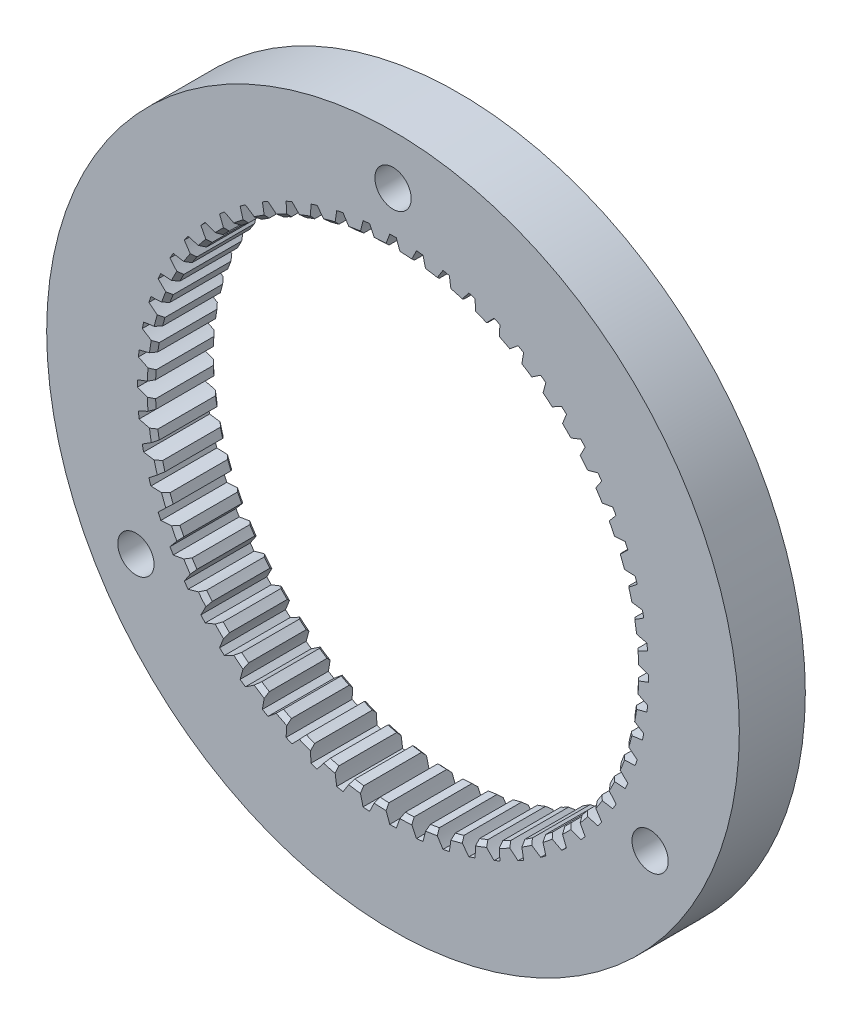
from build123d import *

# Parameters (mm, degrees)
MODEL_R                        = 21
BOSS_EXTRUDE1_DEPTH            = 4
M2_CLEARANCE_HOLE1_D           = 2.2
M2_CLEARANCE_HOLE1_CSINK_D     = 4
M2_CLEARANCE_HOLE1_CSINK_ANGLE = 90
CHAMFER1_SIZE                  = 0.25
CHAMFER2_SIZE                  = 0.25


with BuildPart() as part:
    # Model → Boss-Extrude1 (new body)
    with BuildSketch(Plane.XY):
        Circle(MODEL_R)
        with BuildLine():
            ThreePointArc((14.612478706, -1.037074251), (14.629157739, -0.76668167), (14.640833797, -0.496026894))
            add(Edge.make_bspline(
                [(15.498800652, -0.196378454), (15.258466931, -0.302654065), (15.044300113, -0.379806762), (14.640833797, -0.496026894)],
                knots=[0, 0, 0, 0, 1, 1, 1, 1], degree=3))
            ThreePointArc((15.498800652, -0.196378454), (15.500044715, 0), (15.498800652, 0.196378454))
            add(Edge.make_bspline(
                [(14.640833797, 0.496026894), (15.044300113, 0.379806762), (15.258466931, 0.302654065), (15.498800652, 0.196378454)],
                knots=[0, 0, 0, 0, 1, 1, 1, 1], degree=3))
            ThreePointArc((14.640833797, 0.496026894), (14.629157739, 0.76668167), (14.612478706, 1.037074251))
            add(Edge.make_bspline(
                [(15.434423738, 1.424763143), (15.206515417, 1.293948006), (15.00158648, 1.194831431), (14.612478706, 1.037074251)],
                knots=[0, 0, 0, 0, 1, 1, 1, 1], degree=3))
            ThreePointArc((15.434423738, 1.424763143), (15.415133848, 1.620195855), (15.393369463, 1.815368487))
            add(Edge.make_bspline(
                [(14.508780848, 2.023693465), (14.922185246, 1.950283713), (15.143243489, 1.895940195), (15.393369463, 1.815368487)],
                knots=[0, 0, 0, 0, 1, 1, 1, 1], degree=3))
            ThreePointArc((14.508780848, 2.023693465), (14.468877626, 2.291645085), (14.424026241, 2.558812993))
            add(Edge.make_bspline(
                [(15.200944048, 3.030294736), (14.987958138, 2.876373311), (14.794512327, 2.7563788), (14.424026241, 2.558812993)],
                knots=[0, 0, 0, 0, 1, 1, 1, 1], degree=3))
            ThreePointArc((15.200944048, 3.030294736), (15.161331549, 3.222640504), (15.119285296, 3.414468963))
            add(Edge.make_bspline(
                [(14.217766661, 3.529188026), (14.636579794, 3.499392947), (14.862107501, 3.468454007), (15.119285296, 3.414468963)],
                knots=[0, 0, 0, 0, 1, 1, 1, 1], degree=3))
            ThreePointArc((14.217766661, 3.529188026), (14.150073461, 3.791500757), (14.077541126, 4.052516845))
            add(Edge.make_bspline(
                [(14.800919635, 4.602625786), (14.605189653, 4.427284469), (14.4253464, 4.287726707), (14.077541126, 4.052516845)],
                knots=[0, 0, 0, 0, 1, 1, 1, 1], degree=3))
            ThreePointArc((14.800919635, 4.602625786), (14.741418529, 4.78977723), (14.679551075, 4.976159802))
            add(Edge.make_bspline(
                [(13.770979646, 4.996016065), (14.190612912, 5.0101621), (14.418139154, 5.002966711), (14.679551075, 4.976159802)],
                knots=[0, 0, 0, 0, 1, 1, 1, 1], degree=3))
            ThreePointArc((13.770979646, 4.996016065), (13.67623813, 5.249815953), (13.576819525, 5.501820474))
            add(Edge.make_bspline(
                [(14.238733248, 6.124529505), (14.062403654, 5.929689372), (13.898133359, 5.772097383), (13.576819525, 5.501820474)],
                knots=[0, 0, 0, 0, 1, 1, 1, 1], degree=3))
            ThreePointArc((14.238733248, 6.124529505), (14.159995442, 6.304436155), (14.078984622, 6.483330793))
            add(Edge.make_bspline(
                [(13.173314897, 6.408106706), (13.589170704, 6.466038868), (13.816202657, 6.482665865), (14.078984622, 6.483330793)],
                knots=[0, 0, 0, 0, 1, 1, 1, 1], degree=3))
            ThreePointArc((13.173314897, 6.408106706), (13.052563073, 6.650613067), (12.927347448, 6.890845007))
            add(Edge.make_bspline(
                [(13.52054432, 7.579331596), (13.365547018, 7.367127357), (13.218649461, 7.193227752), (12.927347448, 6.890845007)],
                knots=[0, 0, 0, 0, 1, 1, 1, 1], degree=3))
            ThreePointArc((13.52054432, 7.579331596), (13.423432483, 7.750022357), (13.324165866, 7.919469056))
            add(Edge.make_bspline(
                [(12.431320553, 7.74998879), (12.838842699, 7.851072361), (13.062892953, 7.891339575), (13.324165866, 7.919469056)],
                knots=[0, 0, 0, 0, 1, 1, 1, 1], degree=3))
            ThreePointArc((12.431320553, 7.74998879), (12.285881403, 7.978544672), (12.136240646, 8.204372))
            add(Edge.make_bspline(
                [(12.654221479, 8.951092945), (12.522254652, 8.723849553), (12.394339274, 8.535547612), (12.136240646, 8.204372)],
                knots=[0, 0, 0, 0, 1, 1, 1, 1], degree=3))
            ThreePointArc((12.654221479, 8.951092945), (12.539799588, 9.110697693), (12.423364761, 9.268839958))
            add(Edge.make_bspline(
                [(11.55312606, 9.006960374), (11.947849646, 9.150087863), (12.16646346, 9.213554117), (12.423364761, 9.268839958)],
                knots=[0, 0, 0, 0, 1, 1, 1, 1], degree=3))
            ThreePointArc((11.55312606, 9.006960374), (11.384593046, 9.219061673), (11.212166653, 9.428010176))
            add(Edge.make_bspline(
                [(11.64925634, 10.224784246), (11.541765843, 9.984991427), (11.434234111, 9.784350227), (11.212166653, 9.428010176)],
                knots=[0, 0, 0, 0, 1, 1, 1, 1], degree=3))
            ThreePointArc((11.64925634, 10.224784246), (11.518778024, 10.371554318), (11.386450672, 10.51665951))
            add(Edge.make_bspline(
                [(10.5483531, 10.165249816), (10.925953453, 10.348853087), (11.136735647, 10.434823032), (11.386450672, 10.51665951)],
                knots=[0, 0, 0, 0, 1, 1, 1, 1], degree=3))
            ThreePointArc((10.5483531, 10.165249816), (10.358572704, 10.358572704), (10.165249816, 10.5483531))
            add(Edge.make_bspline(
                [(10.51665951, 11.386450672), (10.434823032, 11.136735647), (10.348853087, 10.925953453), (10.165249816, 10.5483531)],
                knots=[0, 0, 0, 0, 1, 1, 1, 1], degree=3))
            ThreePointArc((10.51665951, 11.386450672), (10.371554318, 11.518778024), (10.224784246, 11.64925634))
            add(Edge.make_bspline(
                [(9.428010176, 11.212166653), (9.784350227, 11.434234111), (9.984991427, 11.541765843), (10.224784246, 11.64925634)],
                knots=[0, 0, 0, 0, 1, 1, 1, 1], degree=3))
            ThreePointArc((9.428010176, 11.212166653), (9.219061673, 11.384593046), (9.006960374, 11.55312606))
            add(Edge.make_bspline(
                [(9.268839958, 12.423364761), (9.213554117, 12.16646346), (9.150087863, 11.947849646), (9.006960374, 11.55312606)],
                knots=[0, 0, 0, 0, 1, 1, 1, 1], degree=3))
            ThreePointArc((9.268839958, 12.423364761), (9.110697693, 12.539799588), (8.951092945, 12.654221479))
            add(Edge.make_bspline(
                [(8.204372, 12.136240646), (8.535547612, 12.394339274), (8.723849553, 12.522254652), (8.951092945, 12.654221479)],
                knots=[0, 0, 0, 0, 1, 1, 1, 1], degree=3))
            ThreePointArc((8.204372, 12.136240646), (7.978544672, 12.285881403), (7.74998879, 12.431320553))
            add(Edge.make_bspline(
                [(7.919469056, 13.324165866), (7.891339575, 13.062892953), (7.851072361, 12.838842699), (7.74998879, 12.431320553)],
                knots=[0, 0, 0, 0, 1, 1, 1, 1], degree=3))
            ThreePointArc((7.919469056, 13.324165866), (7.750022357, 13.423432483), (7.579331596, 13.52054432))
            add(Edge.make_bspline(
                [(6.890845007, 12.927347448), (7.193227752, 13.218649461), (7.367127357, 13.365547018), (7.579331596, 13.52054432)],
                knots=[0, 0, 0, 0, 1, 1, 1, 1], degree=3))
            ThreePointArc((6.890845007, 12.927347448), (6.650613067, 13.052563073), (6.408106706, 13.173314897))
            add(Edge.make_bspline(
                [(6.483330793, 14.078984622), (6.482665865, 13.816202657), (6.466038868, 13.589170704), (6.408106706, 13.173314897)],
                knots=[0, 0, 0, 0, 1, 1, 1, 1], degree=3))
            ThreePointArc((6.483330793, 14.078984622), (6.304436155, 14.159995442), (6.124529505, 14.238733248))
            add(Edge.make_bspline(
                [(5.501820474, 13.576819525), (5.772097383, 13.898133359), (5.929689372, 14.062403654), (6.124529505, 14.238733248)],
                knots=[0, 0, 0, 0, 1, 1, 1, 1], degree=3))
            ThreePointArc((5.501820474, 13.576819525), (5.249815953, 13.67623813), (4.996016065, 13.770979646))
            add(Edge.make_bspline(
                [(4.976159802, 14.679551075), (5.002966711, 14.418139154), (5.0101621, 14.190612912), (4.996016065, 13.770979646)],
                knots=[0, 0, 0, 0, 1, 1, 1, 1], degree=3))
            ThreePointArc((4.976159802, 14.679551075), (4.78977723, 14.741418529), (4.602625786, 14.800919635))
            add(Edge.make_bspline(
                [(4.052516845, 14.077541126), (4.287726707, 14.4253464), (4.427284469, 14.605189653), (4.602625786, 14.800919635)],
                knots=[0, 0, 0, 0, 1, 1, 1, 1], degree=3))
            ThreePointArc((4.052516845, 14.077541126), (3.791500757, 14.150073461), (3.529188026, 14.217766661))
            add(Edge.make_bspline(
                [(3.414468963, 15.119285296), (3.468454007, 14.862107501), (3.499392947, 14.636579794), (3.529188026, 14.217766661)],
                knots=[0, 0, 0, 0, 1, 1, 1, 1], degree=3))
            ThreePointArc((3.414468963, 15.119285296), (3.222640504, 15.161331549), (3.030294736, 15.200944048))
            add(Edge.make_bspline(
                [(2.558812993, 14.424026241), (2.7563788, 14.794512327), (2.876373311, 14.987958138), (3.030294736, 15.200944048)],
                knots=[0, 0, 0, 0, 1, 1, 1, 1], degree=3))
            ThreePointArc((2.558812993, 14.424026241), (2.291645085, 14.468877626), (2.023693465, 14.508780848))
            add(Edge.make_bspline(
                [(1.815368487, 15.393369463), (1.895940195, 15.143243489), (1.950283713, 14.922185246), (2.023693465, 14.508780848)],
                knots=[0, 0, 0, 0, 1, 1, 1, 1], degree=3))
            ThreePointArc((1.815368487, 15.393369463), (1.620195855, 15.415133848), (1.424763143, 15.434423738))
            add(Edge.make_bspline(
                [(1.037074251, 14.612478706), (1.194831431, 15.00158648), (1.293948006, 15.206515417), (1.424763143, 15.434423738)],
                knots=[0, 0, 0, 0, 1, 1, 1, 1], degree=3))
            ThreePointArc((1.037074251, 14.612478706), (0.76668167, 14.629157739), (0.496026894, 14.640833797))
            add(Edge.make_bspline(
                [(0.196378454, 15.498800652), (0.302654065, 15.258466931), (0.379806762, 15.044300113), (0.496026894, 14.640833797)],
                knots=[0, 0, 0, 0, 1, 1, 1, 1], degree=3))
            ThreePointArc((0.196378454, 15.498800652), (0, 15.500044715), (-0.196378454, 15.498800652))
            add(Edge.make_bspline(
                [(-0.496026894, 14.640833797), (-0.379806762, 15.044300113), (-0.302654065, 15.258466931), (-0.196378454, 15.498800652)],
                knots=[0, 0, 0, 0, 1, 1, 1, 1], degree=3))
            ThreePointArc((-0.496026894, 14.640833797), (-0.76668167, 14.629157739), (-1.037074251, 14.612478706))
            add(Edge.make_bspline(
                [(-1.424763143, 15.434423738), (-1.293948006, 15.206515417), (-1.194831431, 15.00158648), (-1.037074251, 14.612478706)],
                knots=[0, 0, 0, 0, 1, 1, 1, 1], degree=3))
            ThreePointArc((-1.424763143, 15.434423738), (-1.620195855, 15.415133848), (-1.815368487, 15.393369463))
            add(Edge.make_bspline(
                [(-2.023693465, 14.508780848), (-1.950283713, 14.922185246), (-1.895940195, 15.143243489), (-1.815368487, 15.393369463)],
                knots=[0, 0, 0, 0, 1, 1, 1, 1], degree=3))
            ThreePointArc((-2.023693465, 14.508780848), (-2.291645085, 14.468877626), (-2.558812993, 14.424026241))
            add(Edge.make_bspline(
                [(-3.030294736, 15.200944048), (-2.876373311, 14.987958138), (-2.7563788, 14.794512327), (-2.558812993, 14.424026241)],
                knots=[0, 0, 0, 0, 1, 1, 1, 1], degree=3))
            ThreePointArc((-3.030294736, 15.200944048), (-3.222640504, 15.161331549), (-3.414468963, 15.119285296))
            add(Edge.make_bspline(
                [(-3.529188026, 14.217766661), (-3.499392947, 14.636579794), (-3.468454007, 14.862107501), (-3.414468963, 15.119285296)],
                knots=[0, 0, 0, 0, 1, 1, 1, 1], degree=3))
            ThreePointArc((-3.529188026, 14.217766661), (-3.791500757, 14.150073461), (-4.052516845, 14.077541126))
            add(Edge.make_bspline(
                [(-4.602625786, 14.800919635), (-4.427284469, 14.605189653), (-4.287726707, 14.4253464), (-4.052516845, 14.077541126)],
                knots=[0, 0, 0, 0, 1, 1, 1, 1], degree=3))
            ThreePointArc((-4.602625786, 14.800919635), (-4.78977723, 14.741418529), (-4.976159802, 14.679551075))
            add(Edge.make_bspline(
                [(-4.996016065, 13.770979646), (-5.0101621, 14.190612912), (-5.002966711, 14.418139154), (-4.976159802, 14.679551075)],
                knots=[0, 0, 0, 0, 1, 1, 1, 1], degree=3))
            ThreePointArc((-4.996016065, 13.770979646), (-5.249815953, 13.67623813), (-5.501820474, 13.576819525))
            add(Edge.make_bspline(
                [(-6.124529505, 14.238733248), (-5.929689372, 14.062403654), (-5.772097383, 13.898133359), (-5.501820474, 13.576819525)],
                knots=[0, 0, 0, 0, 1, 1, 1, 1], degree=3))
            ThreePointArc((-6.124529505, 14.238733248), (-6.304436155, 14.159995442), (-6.483330793, 14.078984622))
            add(Edge.make_bspline(
                [(-6.408106706, 13.173314897), (-6.466038868, 13.589170704), (-6.482665865, 13.816202657), (-6.483330793, 14.078984622)],
                knots=[0, 0, 0, 0, 1, 1, 1, 1], degree=3))
            ThreePointArc((-6.408106706, 13.173314897), (-6.650613067, 13.052563073), (-6.890845007, 12.927347448))
            add(Edge.make_bspline(
                [(-7.579331596, 13.52054432), (-7.367127357, 13.365547018), (-7.193227752, 13.218649461), (-6.890845007, 12.927347448)],
                knots=[0, 0, 0, 0, 1, 1, 1, 1], degree=3))
            ThreePointArc((-7.579331596, 13.52054432), (-7.750022357, 13.423432483), (-7.919469056, 13.324165866))
            add(Edge.make_bspline(
                [(-7.74998879, 12.431320553), (-7.851072361, 12.838842699), (-7.891339575, 13.062892953), (-7.919469056, 13.324165866)],
                knots=[0, 0, 0, 0, 1, 1, 1, 1], degree=3))
            ThreePointArc((-7.74998879, 12.431320553), (-7.978544672, 12.285881403), (-8.204372, 12.136240646))
            add(Edge.make_bspline(
                [(-8.951092945, 12.654221479), (-8.723849553, 12.522254652), (-8.535547612, 12.394339274), (-8.204372, 12.136240646)],
                knots=[0, 0, 0, 0, 1, 1, 1, 1], degree=3))
            ThreePointArc((-8.951092945, 12.654221479), (-9.110697693, 12.539799588), (-9.268839958, 12.423364761))
            add(Edge.make_bspline(
                [(-9.006960374, 11.55312606), (-9.150087863, 11.947849646), (-9.213554117, 12.16646346), (-9.268839958, 12.423364761)],
                knots=[0, 0, 0, 0, 1, 1, 1, 1], degree=3))
            ThreePointArc((-9.006960374, 11.55312606), (-9.219061673, 11.384593046), (-9.428010176, 11.212166653))
            add(Edge.make_bspline(
                [(-10.224784246, 11.64925634), (-9.984991427, 11.541765843), (-9.784350227, 11.434234111), (-9.428010176, 11.212166653)],
                knots=[0, 0, 0, 0, 1, 1, 1, 1], degree=3))
            ThreePointArc((-10.224784246, 11.64925634), (-10.371554318, 11.518778024), (-10.51665951, 11.386450672))
            add(Edge.make_bspline(
                [(-10.165249816, 10.5483531), (-10.348853087, 10.925953453), (-10.434823032, 11.136735647), (-10.51665951, 11.386450672)],
                knots=[0, 0, 0, 0, 1, 1, 1, 1], degree=3))
            ThreePointArc((-10.165249816, 10.5483531), (-10.358572704, 10.358572704), (-10.5483531, 10.165249816))
            add(Edge.make_bspline(
                [(-11.386450672, 10.51665951), (-11.136735647, 10.434823032), (-10.925953453, 10.348853087), (-10.5483531, 10.165249816)],
                knots=[0, 0, 0, 0, 1, 1, 1, 1], degree=3))
            ThreePointArc((-11.386450672, 10.51665951), (-11.518778024, 10.371554318), (-11.64925634, 10.224784246))
            add(Edge.make_bspline(
                [(-11.212166653, 9.428010176), (-11.434234111, 9.784350227), (-11.541765843, 9.984991427), (-11.64925634, 10.224784246)],
                knots=[0, 0, 0, 0, 1, 1, 1, 1], degree=3))
            ThreePointArc((-11.212166653, 9.428010176), (-11.384593046, 9.219061673), (-11.55312606, 9.006960374))
            add(Edge.make_bspline(
                [(-12.423364761, 9.268839958), (-12.16646346, 9.213554117), (-11.947849646, 9.150087863), (-11.55312606, 9.006960374)],
                knots=[0, 0, 0, 0, 1, 1, 1, 1], degree=3))
            ThreePointArc((-12.423364761, 9.268839958), (-12.539799588, 9.110697693), (-12.654221479, 8.951092945))
            add(Edge.make_bspline(
                [(-12.136240646, 8.204372), (-12.394339274, 8.535547612), (-12.522254652, 8.723849553), (-12.654221479, 8.951092945)],
                knots=[0, 0, 0, 0, 1, 1, 1, 1], degree=3))
            ThreePointArc((-12.136240646, 8.204372), (-12.285881403, 7.978544672), (-12.431320553, 7.74998879))
            add(Edge.make_bspline(
                [(-13.324165866, 7.919469056), (-13.062892953, 7.891339575), (-12.838842699, 7.851072361), (-12.431320553, 7.74998879)],
                knots=[0, 0, 0, 0, 1, 1, 1, 1], degree=3))
            ThreePointArc((-13.324165866, 7.919469056), (-13.423432483, 7.750022357), (-13.52054432, 7.579331596))
            add(Edge.make_bspline(
                [(-12.927347448, 6.890845007), (-13.218649461, 7.193227752), (-13.365547018, 7.367127357), (-13.52054432, 7.579331596)],
                knots=[0, 0, 0, 0, 1, 1, 1, 1], degree=3))
            ThreePointArc((-12.927347448, 6.890845007), (-13.052563073, 6.650613067), (-13.173314897, 6.408106706))
            add(Edge.make_bspline(
                [(-14.078984622, 6.483330793), (-13.816202657, 6.482665865), (-13.589170704, 6.466038868), (-13.173314897, 6.408106706)],
                knots=[0, 0, 0, 0, 1, 1, 1, 1], degree=3))
            ThreePointArc((-14.078984622, 6.483330793), (-14.159995442, 6.304436155), (-14.238733248, 6.124529505))
            add(Edge.make_bspline(
                [(-13.576819525, 5.501820474), (-13.898133359, 5.772097383), (-14.062403654, 5.929689372), (-14.238733248, 6.124529505)],
                knots=[0, 0, 0, 0, 1, 1, 1, 1], degree=3))
            ThreePointArc((-13.576819525, 5.501820474), (-13.67623813, 5.249815953), (-13.770979646, 4.996016065))
            add(Edge.make_bspline(
                [(-14.679551075, 4.976159802), (-14.418139154, 5.002966711), (-14.190612912, 5.0101621), (-13.770979646, 4.996016065)],
                knots=[0, 0, 0, 0, 1, 1, 1, 1], degree=3))
            ThreePointArc((-14.679551075, 4.976159802), (-14.741418529, 4.78977723), (-14.800919635, 4.602625786))
            add(Edge.make_bspline(
                [(-14.077541126, 4.052516845), (-14.4253464, 4.287726707), (-14.605189653, 4.427284469), (-14.800919635, 4.602625786)],
                knots=[0, 0, 0, 0, 1, 1, 1, 1], degree=3))
            ThreePointArc((-14.077541126, 4.052516845), (-14.150073461, 3.791500757), (-14.217766661, 3.529188026))
            add(Edge.make_bspline(
                [(-15.119285296, 3.414468963), (-14.862107501, 3.468454007), (-14.636579794, 3.499392947), (-14.217766661, 3.529188026)],
                knots=[0, 0, 0, 0, 1, 1, 1, 1], degree=3))
            ThreePointArc((-15.119285296, 3.414468963), (-15.161331549, 3.222640504), (-15.200944048, 3.030294736))
            add(Edge.make_bspline(
                [(-14.424026241, 2.558812993), (-14.794512327, 2.7563788), (-14.987958138, 2.876373311), (-15.200944048, 3.030294736)],
                knots=[0, 0, 0, 0, 1, 1, 1, 1], degree=3))
            ThreePointArc((-14.424026241, 2.558812993), (-14.468877626, 2.291645085), (-14.508780848, 2.023693465))
            add(Edge.make_bspline(
                [(-15.393369463, 1.815368487), (-15.143243489, 1.895940195), (-14.922185246, 1.950283713), (-14.508780848, 2.023693465)],
                knots=[0, 0, 0, 0, 1, 1, 1, 1], degree=3))
            ThreePointArc((-15.393369463, 1.815368487), (-15.415133848, 1.620195855), (-15.434423738, 1.424763143))
            add(Edge.make_bspline(
                [(-14.612478706, 1.037074251), (-15.00158648, 1.194831431), (-15.206515417, 1.293948006), (-15.434423738, 1.424763143)],
                knots=[0, 0, 0, 0, 1, 1, 1, 1], degree=3))
            ThreePointArc((-14.612478706, 1.037074251), (-14.629157739, 0.76668167), (-14.640833797, 0.496026894))
            add(Edge.make_bspline(
                [(-15.498800652, 0.196378454), (-15.258466931, 0.302654065), (-15.044300113, 0.379806762), (-14.640833797, 0.496026894)],
                knots=[0, 0, 0, 0, 1, 1, 1, 1], degree=3))
            ThreePointArc((-15.498800652, 0.196378454), (-15.500044715, 0), (-15.498800652, -0.196378454))
            add(Edge.make_bspline(
                [(-14.640833797, -0.496026894), (-15.044300113, -0.379806762), (-15.258466931, -0.302654065), (-15.498800652, -0.196378454)],
                knots=[0, 0, 0, 0, 1, 1, 1, 1], degree=3))
            ThreePointArc((-14.640833797, -0.496026894), (-14.629157739, -0.76668167), (-14.612478706, -1.037074251))
            add(Edge.make_bspline(
                [(-15.434423738, -1.424763143), (-15.206515417, -1.293948006), (-15.00158648, -1.194831431), (-14.612478706, -1.037074251)],
                knots=[0, 0, 0, 0, 1, 1, 1, 1], degree=3))
            ThreePointArc((-15.434423738, -1.424763143), (-15.415133848, -1.620195855), (-15.393369463, -1.815368487))
            add(Edge.make_bspline(
                [(-14.508780848, -2.023693465), (-14.922185246, -1.950283713), (-15.143243489, -1.895940195), (-15.393369463, -1.815368487)],
                knots=[0, 0, 0, 0, 1, 1, 1, 1], degree=3))
            ThreePointArc((-14.508780848, -2.023693465), (-14.468877626, -2.291645085), (-14.424026241, -2.558812993))
            add(Edge.make_bspline(
                [(-15.200944048, -3.030294736), (-14.987958138, -2.876373311), (-14.794512327, -2.7563788), (-14.424026241, -2.558812993)],
                knots=[0, 0, 0, 0, 1, 1, 1, 1], degree=3))
            ThreePointArc((-15.200944048, -3.030294736), (-15.161331549, -3.222640504), (-15.119285296, -3.414468963))
            add(Edge.make_bspline(
                [(-14.217766661, -3.529188026), (-14.636579794, -3.499392947), (-14.862107501, -3.468454007), (-15.119285296, -3.414468963)],
                knots=[0, 0, 0, 0, 1, 1, 1, 1], degree=3))
            ThreePointArc((-14.217766661, -3.529188026), (-14.150073461, -3.791500757), (-14.077541126, -4.052516845))
            add(Edge.make_bspline(
                [(-14.800919635, -4.602625786), (-14.605189653, -4.427284469), (-14.4253464, -4.287726707), (-14.077541126, -4.052516845)],
                knots=[0, 0, 0, 0, 1, 1, 1, 1], degree=3))
            ThreePointArc((-14.800919635, -4.602625786), (-14.741418529, -4.78977723), (-14.679551075, -4.976159802))
            add(Edge.make_bspline(
                [(-13.770979646, -4.996016065), (-14.190612912, -5.0101621), (-14.418139154, -5.002966711), (-14.679551075, -4.976159802)],
                knots=[0, 0, 0, 0, 1, 1, 1, 1], degree=3))
            ThreePointArc((-13.770979646, -4.996016065), (-13.67623813, -5.249815953), (-13.576819525, -5.501820474))
            add(Edge.make_bspline(
                [(-14.238733248, -6.124529505), (-14.062403654, -5.929689372), (-13.898133359, -5.772097383), (-13.576819525, -5.501820474)],
                knots=[0, 0, 0, 0, 1, 1, 1, 1], degree=3))
            ThreePointArc((-14.238733248, -6.124529505), (-14.159995442, -6.304436155), (-14.078984622, -6.483330793))
            add(Edge.make_bspline(
                [(-13.173314897, -6.408106706), (-13.589170704, -6.466038868), (-13.816202657, -6.482665865), (-14.078984622, -6.483330793)],
                knots=[0, 0, 0, 0, 1, 1, 1, 1], degree=3))
            ThreePointArc((-13.173314897, -6.408106706), (-13.052563073, -6.650613067), (-12.927347448, -6.890845007))
            add(Edge.make_bspline(
                [(-13.52054432, -7.579331596), (-13.365547018, -7.367127357), (-13.218649461, -7.193227752), (-12.927347448, -6.890845007)],
                knots=[0, 0, 0, 0, 1, 1, 1, 1], degree=3))
            ThreePointArc((-13.52054432, -7.579331596), (-13.423432483, -7.750022357), (-13.324165866, -7.919469056))
            add(Edge.make_bspline(
                [(-12.431320553, -7.74998879), (-12.838842699, -7.851072361), (-13.062892953, -7.891339575), (-13.324165866, -7.919469056)],
                knots=[0, 0, 0, 0, 1, 1, 1, 1], degree=3))
            ThreePointArc((-12.431320553, -7.74998879), (-12.285881403, -7.978544672), (-12.136240646, -8.204372))
            add(Edge.make_bspline(
                [(-12.654221479, -8.951092945), (-12.522254652, -8.723849553), (-12.394339274, -8.535547612), (-12.136240646, -8.204372)],
                knots=[0, 0, 0, 0, 1, 1, 1, 1], degree=3))
            ThreePointArc((-12.654221479, -8.951092945), (-12.539799588, -9.110697693), (-12.423364761, -9.268839958))
            add(Edge.make_bspline(
                [(-11.55312606, -9.006960374), (-11.947849646, -9.150087863), (-12.16646346, -9.213554117), (-12.423364761, -9.268839958)],
                knots=[0, 0, 0, 0, 1, 1, 1, 1], degree=3))
            ThreePointArc((-11.55312606, -9.006960374), (-11.384593046, -9.219061673), (-11.212166653, -9.428010176))
            add(Edge.make_bspline(
                [(-11.64925634, -10.224784246), (-11.541765843, -9.984991427), (-11.434234111, -9.784350227), (-11.212166653, -9.428010176)],
                knots=[0, 0, 0, 0, 1, 1, 1, 1], degree=3))
            ThreePointArc((-11.64925634, -10.224784246), (-11.518778024, -10.371554318), (-11.386450672, -10.51665951))
            add(Edge.make_bspline(
                [(-10.5483531, -10.165249816), (-10.925953453, -10.348853087), (-11.136735647, -10.434823032), (-11.386450672, -10.51665951)],
                knots=[0, 0, 0, 0, 1, 1, 1, 1], degree=3))
            ThreePointArc((-10.5483531, -10.165249816), (-10.358572704, -10.358572704), (-10.165249816, -10.5483531))
            add(Edge.make_bspline(
                [(-10.51665951, -11.386450672), (-10.434823032, -11.136735647), (-10.348853087, -10.925953453), (-10.165249816, -10.5483531)],
                knots=[0, 0, 0, 0, 1, 1, 1, 1], degree=3))
            ThreePointArc((-10.51665951, -11.386450672), (-10.371554318, -11.518778024), (-10.224784246, -11.64925634))
            add(Edge.make_bspline(
                [(-9.428010176, -11.212166653), (-9.784350227, -11.434234111), (-9.984991427, -11.541765843), (-10.224784246, -11.64925634)],
                knots=[0, 0, 0, 0, 1, 1, 1, 1], degree=3))
            ThreePointArc((-9.428010176, -11.212166653), (-9.219061673, -11.384593046), (-9.006960374, -11.55312606))
            add(Edge.make_bspline(
                [(-9.268839958, -12.423364761), (-9.213554117, -12.16646346), (-9.150087863, -11.947849646), (-9.006960374, -11.55312606)],
                knots=[0, 0, 0, 0, 1, 1, 1, 1], degree=3))
            ThreePointArc((-9.268839958, -12.423364761), (-9.110697693, -12.539799588), (-8.951092945, -12.654221479))
            add(Edge.make_bspline(
                [(-8.204372, -12.136240646), (-8.535547612, -12.394339274), (-8.723849553, -12.522254652), (-8.951092945, -12.654221479)],
                knots=[0, 0, 0, 0, 1, 1, 1, 1], degree=3))
            ThreePointArc((-8.204372, -12.136240646), (-7.978544672, -12.285881403), (-7.74998879, -12.431320553))
            add(Edge.make_bspline(
                [(-7.919469056, -13.324165866), (-7.891339575, -13.062892953), (-7.851072361, -12.838842699), (-7.74998879, -12.431320553)],
                knots=[0, 0, 0, 0, 1, 1, 1, 1], degree=3))
            ThreePointArc((-7.919469056, -13.324165866), (-7.750022357, -13.423432483), (-7.579331596, -13.52054432))
            add(Edge.make_bspline(
                [(-6.890845007, -12.927347448), (-7.193227752, -13.218649461), (-7.367127357, -13.365547018), (-7.579331596, -13.52054432)],
                knots=[0, 0, 0, 0, 1, 1, 1, 1], degree=3))
            ThreePointArc((-6.890845007, -12.927347448), (-6.650613067, -13.052563073), (-6.408106706, -13.173314897))
            add(Edge.make_bspline(
                [(-6.483330793, -14.078984622), (-6.482665865, -13.816202657), (-6.466038868, -13.589170704), (-6.408106706, -13.173314897)],
                knots=[0, 0, 0, 0, 1, 1, 1, 1], degree=3))
            ThreePointArc((-6.483330793, -14.078984622), (-6.304436155, -14.159995442), (-6.124529505, -14.238733248))
            add(Edge.make_bspline(
                [(-5.501820474, -13.576819525), (-5.772097383, -13.898133359), (-5.929689372, -14.062403654), (-6.124529505, -14.238733248)],
                knots=[0, 0, 0, 0, 1, 1, 1, 1], degree=3))
            ThreePointArc((-5.501820474, -13.576819525), (-5.249815953, -13.67623813), (-4.996016065, -13.770979646))
            add(Edge.make_bspline(
                [(-4.976159802, -14.679551075), (-5.002966711, -14.418139154), (-5.0101621, -14.190612912), (-4.996016065, -13.770979646)],
                knots=[0, 0, 0, 0, 1, 1, 1, 1], degree=3))
            ThreePointArc((-4.976159802, -14.679551075), (-4.78977723, -14.741418529), (-4.602625786, -14.800919635))
            add(Edge.make_bspline(
                [(-4.052516845, -14.077541126), (-4.287726707, -14.4253464), (-4.427284469, -14.605189653), (-4.602625786, -14.800919635)],
                knots=[0, 0, 0, 0, 1, 1, 1, 1], degree=3))
            ThreePointArc((-4.052516845, -14.077541126), (-3.791500757, -14.150073461), (-3.529188026, -14.217766661))
            add(Edge.make_bspline(
                [(-3.414468963, -15.119285296), (-3.468454007, -14.862107501), (-3.499392947, -14.636579794), (-3.529188026, -14.217766661)],
                knots=[0, 0, 0, 0, 1, 1, 1, 1], degree=3))
            ThreePointArc((-3.414468963, -15.119285296), (-3.222640504, -15.161331549), (-3.030294736, -15.200944048))
            add(Edge.make_bspline(
                [(-2.558812993, -14.424026241), (-2.7563788, -14.794512327), (-2.876373311, -14.987958138), (-3.030294736, -15.200944048)],
                knots=[0, 0, 0, 0, 1, 1, 1, 1], degree=3))
            ThreePointArc((-2.558812993, -14.424026241), (-2.291645085, -14.468877626), (-2.023693465, -14.508780848))
            add(Edge.make_bspline(
                [(-1.815368487, -15.393369463), (-1.895940195, -15.143243489), (-1.950283713, -14.922185246), (-2.023693465, -14.508780848)],
                knots=[0, 0, 0, 0, 1, 1, 1, 1], degree=3))
            ThreePointArc((-1.815368487, -15.393369463), (-1.620195855, -15.415133848), (-1.424763143, -15.434423738))
            add(Edge.make_bspline(
                [(-1.037074251, -14.612478706), (-1.194831431, -15.00158648), (-1.293948006, -15.206515417), (-1.424763143, -15.434423738)],
                knots=[0, 0, 0, 0, 1, 1, 1, 1], degree=3))
            ThreePointArc((-1.037074251, -14.612478706), (-0.76668167, -14.629157739), (-0.496026894, -14.640833797))
            add(Edge.make_bspline(
                [(-0.196378454, -15.498800652), (-0.302654065, -15.258466931), (-0.379806762, -15.044300113), (-0.496026894, -14.640833797)],
                knots=[0, 0, 0, 0, 1, 1, 1, 1], degree=3))
            ThreePointArc((-0.196378454, -15.498800652), (0, -15.500044715), (0.196378454, -15.498800652))
            add(Edge.make_bspline(
                [(0.496026894, -14.640833797), (0.379806762, -15.044300113), (0.302654065, -15.258466931), (0.196378454, -15.498800652)],
                knots=[0, 0, 0, 0, 1, 1, 1, 1], degree=3))
            ThreePointArc((0.496026894, -14.640833797), (0.76668167, -14.629157739), (1.037074251, -14.612478706))
            add(Edge.make_bspline(
                [(1.424763143, -15.434423738), (1.293948006, -15.206515417), (1.194831431, -15.00158648), (1.037074251, -14.612478706)],
                knots=[0, 0, 0, 0, 1, 1, 1, 1], degree=3))
            ThreePointArc((1.424763143, -15.434423738), (1.620195855, -15.415133848), (1.815368487, -15.393369463))
            add(Edge.make_bspline(
                [(2.023693465, -14.508780848), (1.950283713, -14.922185246), (1.895940195, -15.143243489), (1.815368487, -15.393369463)],
                knots=[0, 0, 0, 0, 1, 1, 1, 1], degree=3))
            ThreePointArc((2.023693465, -14.508780848), (2.291645085, -14.468877626), (2.558812993, -14.424026241))
            add(Edge.make_bspline(
                [(3.030294736, -15.200944048), (2.876373311, -14.987958138), (2.7563788, -14.794512327), (2.558812993, -14.424026241)],
                knots=[0, 0, 0, 0, 1, 1, 1, 1], degree=3))
            ThreePointArc((3.030294736, -15.200944048), (3.222640504, -15.161331549), (3.414468963, -15.119285296))
            add(Edge.make_bspline(
                [(3.529188026, -14.217766661), (3.499392947, -14.636579794), (3.468454007, -14.862107501), (3.414468963, -15.119285296)],
                knots=[0, 0, 0, 0, 1, 1, 1, 1], degree=3))
            ThreePointArc((3.529188026, -14.217766661), (3.791500757, -14.150073461), (4.052516845, -14.077541126))
            add(Edge.make_bspline(
                [(4.602625786, -14.800919635), (4.427284469, -14.605189653), (4.287726707, -14.4253464), (4.052516845, -14.077541126)],
                knots=[0, 0, 0, 0, 1, 1, 1, 1], degree=3))
            ThreePointArc((4.602625786, -14.800919635), (4.78977723, -14.741418529), (4.976159802, -14.679551075))
            add(Edge.make_bspline(
                [(4.996016065, -13.770979646), (5.0101621, -14.190612912), (5.002966711, -14.418139154), (4.976159802, -14.679551075)],
                knots=[0, 0, 0, 0, 1, 1, 1, 1], degree=3))
            ThreePointArc((4.996016065, -13.770979646), (5.249815953, -13.67623813), (5.501820474, -13.576819525))
            add(Edge.make_bspline(
                [(6.124529505, -14.238733248), (5.929689372, -14.062403654), (5.772097383, -13.898133359), (5.501820474, -13.576819525)],
                knots=[0, 0, 0, 0, 1, 1, 1, 1], degree=3))
            ThreePointArc((6.124529505, -14.238733248), (6.304436155, -14.159995442), (6.483330793, -14.078984622))
            add(Edge.make_bspline(
                [(6.408106706, -13.173314897), (6.466038868, -13.589170704), (6.482665865, -13.816202657), (6.483330793, -14.078984622)],
                knots=[0, 0, 0, 0, 1, 1, 1, 1], degree=3))
            ThreePointArc((6.408106706, -13.173314897), (6.650613067, -13.052563073), (6.890845007, -12.927347448))
            add(Edge.make_bspline(
                [(7.579331596, -13.52054432), (7.367127357, -13.365547018), (7.193227752, -13.218649461), (6.890845007, -12.927347448)],
                knots=[0, 0, 0, 0, 1, 1, 1, 1], degree=3))
            ThreePointArc((7.579331596, -13.52054432), (7.750022357, -13.423432483), (7.919469056, -13.324165866))
            add(Edge.make_bspline(
                [(7.74998879, -12.431320553), (7.851072361, -12.838842699), (7.891339575, -13.062892953), (7.919469056, -13.324165866)],
                knots=[0, 0, 0, 0, 1, 1, 1, 1], degree=3))
            ThreePointArc((7.74998879, -12.431320553), (7.978544672, -12.285881403), (8.204372, -12.136240646))
            add(Edge.make_bspline(
                [(8.951092945, -12.654221479), (8.723849553, -12.522254652), (8.535547612, -12.394339274), (8.204372, -12.136240646)],
                knots=[0, 0, 0, 0, 1, 1, 1, 1], degree=3))
            ThreePointArc((8.951092945, -12.654221479), (9.110697693, -12.539799588), (9.268839958, -12.423364761))
            add(Edge.make_bspline(
                [(9.006960374, -11.55312606), (9.150087863, -11.947849646), (9.213554117, -12.16646346), (9.268839958, -12.423364761)],
                knots=[0, 0, 0, 0, 1, 1, 1, 1], degree=3))
            ThreePointArc((9.006960374, -11.55312606), (9.219061673, -11.384593046), (9.428010176, -11.212166653))
            add(Edge.make_bspline(
                [(10.224784246, -11.64925634), (9.984991427, -11.541765843), (9.784350227, -11.434234111), (9.428010176, -11.212166653)],
                knots=[0, 0, 0, 0, 1, 1, 1, 1], degree=3))
            ThreePointArc((10.224784246, -11.64925634), (10.371554318, -11.518778024), (10.51665951, -11.386450672))
            add(Edge.make_bspline(
                [(10.165249816, -10.5483531), (10.348853087, -10.925953453), (10.434823032, -11.136735647), (10.51665951, -11.386450672)],
                knots=[0, 0, 0, 0, 1, 1, 1, 1], degree=3))
            ThreePointArc((10.165249816, -10.5483531), (10.358572704, -10.358572704), (10.5483531, -10.165249816))
            add(Edge.make_bspline(
                [(11.386450672, -10.51665951), (11.136735647, -10.434823032), (10.925953453, -10.348853087), (10.5483531, -10.165249816)],
                knots=[0, 0, 0, 0, 1, 1, 1, 1], degree=3))
            ThreePointArc((11.386450672, -10.51665951), (11.518778024, -10.371554318), (11.64925634, -10.224784246))
            add(Edge.make_bspline(
                [(11.212166653, -9.428010176), (11.434234111, -9.784350227), (11.541765843, -9.984991427), (11.64925634, -10.224784246)],
                knots=[0, 0, 0, 0, 1, 1, 1, 1], degree=3))
            ThreePointArc((11.212166653, -9.428010176), (11.384593046, -9.219061673), (11.55312606, -9.006960374))
            add(Edge.make_bspline(
                [(12.423364761, -9.268839958), (12.16646346, -9.213554117), (11.947849646, -9.150087863), (11.55312606, -9.006960374)],
                knots=[0, 0, 0, 0, 1, 1, 1, 1], degree=3))
            ThreePointArc((12.423364761, -9.268839958), (12.539799588, -9.110697693), (12.654221479, -8.951092945))
            add(Edge.make_bspline(
                [(12.136240646, -8.204372), (12.394339274, -8.535547612), (12.522254652, -8.723849553), (12.654221479, -8.951092945)],
                knots=[0, 0, 0, 0, 1, 1, 1, 1], degree=3))
            ThreePointArc((12.136240646, -8.204372), (12.285881403, -7.978544672), (12.431320553, -7.74998879))
            add(Edge.make_bspline(
                [(13.324165866, -7.919469056), (13.062892953, -7.891339575), (12.838842699, -7.851072361), (12.431320553, -7.74998879)],
                knots=[0, 0, 0, 0, 1, 1, 1, 1], degree=3))
            ThreePointArc((13.324165866, -7.919469056), (13.423432483, -7.750022357), (13.52054432, -7.579331596))
            add(Edge.make_bspline(
                [(12.927347448, -6.890845007), (13.218649461, -7.193227752), (13.365547018, -7.367127357), (13.52054432, -7.579331596)],
                knots=[0, 0, 0, 0, 1, 1, 1, 1], degree=3))
            ThreePointArc((12.927347448, -6.890845007), (13.052563073, -6.650613067), (13.173314897, -6.408106706))
            add(Edge.make_bspline(
                [(14.078984622, -6.483330793), (13.816202657, -6.482665865), (13.589170704, -6.466038868), (13.173314897, -6.408106706)],
                knots=[0, 0, 0, 0, 1, 1, 1, 1], degree=3))
            ThreePointArc((14.078984622, -6.483330793), (14.159995442, -6.304436155), (14.238733248, -6.124529505))
            add(Edge.make_bspline(
                [(13.576819525, -5.501820474), (13.898133359, -5.772097383), (14.062403654, -5.929689372), (14.238733248, -6.124529505)],
                knots=[0, 0, 0, 0, 1, 1, 1, 1], degree=3))
            ThreePointArc((13.576819525, -5.501820474), (13.67623813, -5.249815953), (13.770979646, -4.996016065))
            add(Edge.make_bspline(
                [(14.679551075, -4.976159802), (14.418139154, -5.002966711), (14.190612912, -5.0101621), (13.770979646, -4.996016065)],
                knots=[0, 0, 0, 0, 1, 1, 1, 1], degree=3))
            ThreePointArc((14.679551075, -4.976159802), (14.741418529, -4.78977723), (14.800919635, -4.602625786))
            add(Edge.make_bspline(
                [(14.077541126, -4.052516845), (14.4253464, -4.287726707), (14.605189653, -4.427284469), (14.800919635, -4.602625786)],
                knots=[0, 0, 0, 0, 1, 1, 1, 1], degree=3))
            ThreePointArc((14.077541126, -4.052516845), (14.150073461, -3.791500757), (14.217766661, -3.529188026))
            add(Edge.make_bspline(
                [(15.119285296, -3.414468963), (14.862107501, -3.468454007), (14.636579794, -3.499392947), (14.217766661, -3.529188026)],
                knots=[0, 0, 0, 0, 1, 1, 1, 1], degree=3))
            ThreePointArc((15.119285296, -3.414468963), (15.161331549, -3.222640504), (15.200944048, -3.030294736))
            add(Edge.make_bspline(
                [(14.424026241, -2.558812993), (14.794512327, -2.7563788), (14.987958138, -2.876373311), (15.200944048, -3.030294736)],
                knots=[0, 0, 0, 0, 1, 1, 1, 1], degree=3))
            ThreePointArc((14.424026241, -2.558812993), (14.468877626, -2.291645085), (14.508780848, -2.023693465))
            add(Edge.make_bspline(
                [(15.393369463, -1.815368487), (15.143243489, -1.895940195), (14.922185246, -1.950283713), (14.508780848, -2.023693465)],
                knots=[0, 0, 0, 0, 1, 1, 1, 1], degree=3))
            ThreePointArc((15.393369463, -1.815368487), (15.415133848, -1.620195855), (15.434423738, -1.424763143))
            add(Edge.make_bspline(
                [(14.612478706, -1.037074251), (15.00158648, -1.194831431), (15.206515417, -1.293948006), (15.434423738, -1.424763143)],
                knots=[0, 0, 0, 0, 1, 1, 1, 1], degree=3))
        make_face(mode=Mode.SUBTRACT)
    extrude(amount=BOSS_EXTRUDE1_DEPTH)

    # M2 Clearance Hole1 (through all)
    with Locations(Plane(origin=(0, 0, 0), x_dir=(-1, 0, 0), z_dir=(0, 0, -1))):
        with Locations((0, 18), (15.588457268, -9), (-15.588457268, -9)):
            CounterSinkHole(M2_CLEARANCE_HOLE1_D / 2, M2_CLEARANCE_HOLE1_CSINK_D / 2, counter_sink_angle=M2_CLEARANCE_HOLE1_CSINK_ANGLE)

    # Chamfer1
    chamfer1_edges = [part.edges().sort_by_distance(p)[0] for p in [
        (12.285881403, -7.978544672, 0),
        (13.052563073, -6.650613067, 0),
        (13.67623813, -5.249815953, 0),
        (14.150073461, -3.791500757, 0),
        (14.468877626, -2.291645085, 0),
        (14.629157739, -0.76668167, 0),
        (14.629157739, 0.76668167, 0),
        (14.468877626, 2.291645085, 0),
        (14.150073461, 3.791500757, 0),
        (11.384593046, -9.219061673, 0),
        (10.358572704, -10.358572704, 0),
        (9.219061673, -11.384593046, 0),
        (6.650613067, -13.052563073, 0),
        (7.978544672, -12.285881403, 0),
        (5.249815953, -13.67623813, 0),
        (3.791500757, -14.150073461, 0),
        (2.291645085, -14.468877626, 0),
        (0.76668167, -14.629157739, 0),
        (-0.76668167, -14.629157739, 0),
        (-2.291645085, -14.468877626, 0),
        (-3.791500757, -14.150073461, 0),
        (-5.249815953, -13.67623813, 0),
        (-6.650613067, -13.052563073, 0),
        (-7.978544672, -12.285881403, 0),
        (13.67623813, 5.249815953, 0),
        (13.052563073, 6.650613067, 0),
        (-14.468877626, 2.291645085, 0),
        (-14.150073461, 3.791500757, 0),
        (-13.67623813, 5.249815953, 0),
        (-13.052563073, 6.650613067, 0),
        (-12.285881403, 7.978544672, 0),
        (-11.384593046, 9.219061673, 0),
        (-10.358572704, 10.358572704, 0),
        (-14.629157739, 0.76668167, 0),
        (-9.219061673, -11.384593046, 0),
        (-10.358572704, -10.358572704, 0),
        (-14.629157739, -0.76668167, 0),
        (-14.468877626, -2.291645085, 0),
        (-14.150073461, -3.791500757, 0),
        (-13.67623813, -5.249815953, 0),
        (-13.052563073, -6.650613067, 0),
        (-12.285881403, -7.978544672, 0),
        (-11.384593046, -9.219061673, 0),
        (-9.219061673, 11.384593046, 0),
        (-7.978544672, 12.285881403, 0),
        (-6.650613067, 13.052563073, 0),
        (-5.249815953, 13.67623813, 0),
        (-3.791500757, 14.150073461, 0),
        (-2.291645085, 14.468877626, 0),
        (-0.76668167, 14.629157739, 0),
        (0.76668167, 14.629157739, 0),
        (2.291645085, 14.468877626, 0),
        (3.791500757, 14.150073461, 0),
        (5.249815953, 13.67623813, 0),
        (6.650613067, 13.052563073, 0),
        (7.978544672, 12.285881403, 0),
        (9.219061673, 11.384593046, 0),
        (10.358572704, 10.358572704, 0),
        (11.384593046, 9.219061673, 0),
        (12.285881403, 7.978544672, 0),
    ]]
    chamfer(chamfer1_edges, length=CHAMFER1_SIZE)

    # Chamfer2
    chamfer2_edges = [part.edges().sort_by_distance(p)[0] for p in [
        (-7.978544672, -12.285881403, 4),
        (-9.219061673, -11.384593046, 4),
        (-10.358572704, -10.358572704, 4),
        (-11.384593046, -9.219061673, 4),
        (-12.285881403, -7.978544672, 4),
        (-13.052563073, -6.650613067, 4),
        (-13.67623813, -5.249815953, 4),
        (-14.150073461, -3.791500757, 4),
        (-14.468877626, -2.291645085, 4),
        (-6.650613067, -13.052563073, 4),
        (-5.249815953, -13.67623813, 4),
        (-3.791500757, -14.150073461, 4),
        (-2.291645085, -14.468877626, 4),
        (-0.76668167, -14.629157739, 4),
        (0.76668167, -14.629157739, 4),
        (2.291645085, -14.468877626, 4),
        (3.791500757, -14.150073461, 4),
        (5.249815953, -13.67623813, 4),
        (6.650613067, -13.052563073, 4),
        (7.978544672, -12.285881403, 4),
        (9.219061673, -11.384593046, 4),
        (10.358572704, -10.358572704, 4),
        (11.384593046, -9.219061673, 4),
        (12.285881403, -7.978544672, 4),
        (13.052563073, -6.650613067, 4),
        (13.67623813, -5.249815953, 4),
        (14.150073461, -3.791500757, 4),
        (14.468877626, -2.291645085, 4),
        (14.629157739, -0.76668167, 4),
        (14.629157739, 0.76668167, 4),
        (14.468877626, 2.291645085, 4),
        (14.150073461, 3.791500757, 4),
        (13.67623813, 5.249815953, 4),
        (13.052563073, 6.650613067, 4),
        (12.285881403, 7.978544672, 4),
        (11.384593046, 9.219061673, 4),
        (10.358572704, 10.358572704, 4),
        (-14.629157739, -0.76668167, 4),
        (-14.629157739, 0.76668167, 4),
        (-14.468877626, 2.291645085, 4),
        (-14.150073461, 3.791500757, 4),
        (-13.67623813, 5.249815953, 4),
        (9.219061673, 11.384593046, 4),
        (7.978544672, 12.285881403, 4),
        (6.650613067, 13.052563073, 4),
        (5.249815953, 13.67623813, 4),
        (-13.052563073, 6.650613067, 4),
        (-12.285881403, 7.978544672, 4),
        (-11.384593046, 9.219061673, 4),
        (-10.358572704, 10.358572704, 4),
        (-9.219061673, 11.384593046, 4),
        (-7.978544672, 12.285881403, 4),
        (3.791500757, 14.150073461, 4),
        (2.291645085, 14.468877626, 4),
        (0.76668167, 14.629157739, 4),
        (-0.76668167, 14.629157739, 4),
        (-2.291645085, 14.468877626, 4),
        (-3.791500757, 14.150073461, 4),
        (-5.249815953, 13.67623813, 4),
        (-6.650613067, 13.052563073, 4),
    ]]
    chamfer(chamfer2_edges, length=CHAMFER2_SIZE)


solid = part.part
